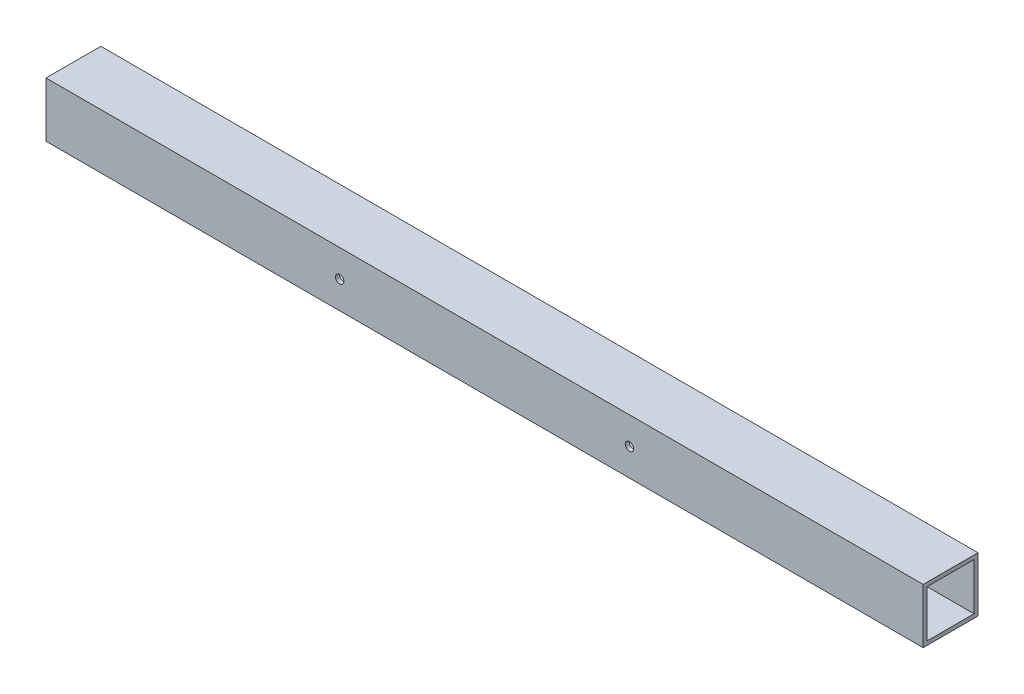
from build123d import *

# Parameters (mm, degrees)
BOSS_EXTRUDE1_DEPTH              = 355.6
BOSS_EXTRUDE1_DEPTH_BACK         = 355.6
SKETCH1_W                        = 44.45
SKETCH1_H                        = 44.45
SKETCH1_W_2                      = 38.1
SKETCH1_H_2                      = 38.1
F_17_64_0_26563_DIAMETER_HOLE1_D = 6.747002


with BuildPart() as part:
    # Sketch1 → Boss-Extrude1 (new, two sides: drawn at the far end of the back side and taken through both)
    with BuildSketch(Plane(origin=(0, 0, 0), x_dir=(0, 0, -1), z_dir=(1, 0, 0)).offset(-BOSS_EXTRUDE1_DEPTH_BACK)):
        Rectangle(SKETCH1_W, SKETCH1_H)
        Rectangle(SKETCH1_W_2, SKETCH1_H_2, mode=Mode.SUBTRACT)
    extrude(amount=BOSS_EXTRUDE1_DEPTH + BOSS_EXTRUDE1_DEPTH_BACK)

    # 17/64 (0.26563) Diameter Hole1 (through all)
    with Locations(Plane.XY.offset(22.225)):
        with Locations((-117.475, 0), (117.475, 0)):
            Hole(F_17_64_0_26563_DIAMETER_HOLE1_D / 2)


solid = part.part
